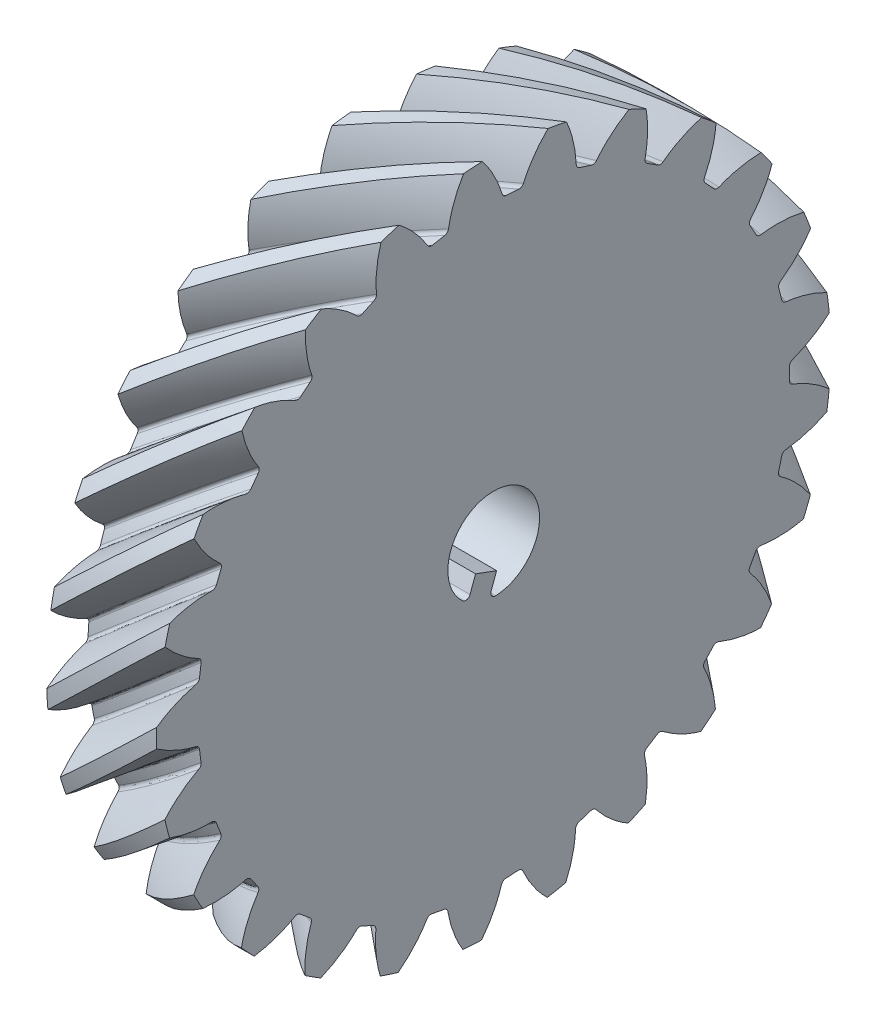
from build123d import *

# Parameters (mm, degrees)
BASPROSKE_W            = 12
BASPROSKE_H            = 36.754089775
TOOTHCUTLH_PITCH       = 239.137870171
TOOTHCUTLH_HEIGHT      = 12
TOOTHCUTLH_RADIUS      = 36.754089775
TOOTHCUTLH_START_ANGLE = -90
TEETHCUTSLH_COUNT      = 25
TEETHCUTSLH_ANGLE      = 345.6
BORSKE_R               = 5
BORE_DEPTH             = 62.5000025
BOSS_EXTRUDE1_DEPTH    = 12
FILLET1_R              = 0.5


with BuildPart() as part:
    # BasProSke → Base-Revolve (revolve)
    with BuildSketch(Plane(origin=(0, 0, 0), x_dir=(1, 0, 0), z_dir=(0, 1, 0)), mode=Mode.PRIVATE) as base_revolve_sk:
        with Locations((6, 18.377044888)):
            Rectangle(BASPROSKE_W, BASPROSKE_H)
    revolve(base_revolve_sk.sketch.rotate(Axis((-10, 0, 0), (1, 0, 0)), 180), axis=Axis((-10, 0, 0), (1, 0, 0)))

    # ToothCutLH: sweep along a helix
    with BuildLine() as toothcutlh_path:
        add(Helix(TOOTHCUTLH_PITCH, TOOTHCUTLH_HEIGHT, TOOTHCUTLH_RADIUS, center=(0, 0, 0), direction=(1, 0, 0), lefthand=True, mode=Mode.PRIVATE).rotate(Axis((0, 0, 0), (1, 0, 0)), TOOTHCUTLH_START_ANGLE))
    # TooCutSkeRH<3> → ToothCutLH (sweep, cut)
    with BuildSketch(Plane(origin=(0, 0, 0), x_dir=(0, 0, -1), z_dir=(1, 0, 0))):
        with BuildLine():
            ThreePointArc((0.679234719, 32.246937024), (0, 32.254089775), (-0.679234719, 32.246937024))
            ThreePointArc((-0.679234719, 32.246937024), (-0.971295349, 32.333394933), (-1.159304884, 32.57303382))
            ThreePointArc((-1.159304884, 32.57303382), (-2.568571771, 35.286618057), (-4.594479365, 37.576873716))
            ThreePointArc((-4.594479365, 37.576873716), (0, 37.856712469), (4.594479365, 37.576873716))
            ThreePointArc((4.594479365, 37.576873716), (2.568571771, 35.286618057), (1.159304884, 32.57303382))
            ThreePointArc((1.159304884, 32.57303382), (0.971295349, 32.333394933), (0.679234719, 32.246937024))
        make_face()
    toothcutlh = sweep(path=toothcutlh_path.line, is_frenet=True, mode=Mode.SUBTRACT)

    # TeethCutsLH: ToothCutLH ×25 about axis
    teethcutslh_axis = Axis((-10, 0, 0), (1, 0, 0))
    for i in range(1, TEETHCUTSLH_COUNT):
        add(toothcutlh.rotate(teethcutslh_axis, i * TEETHCUTSLH_ANGLE / (TEETHCUTSLH_COUNT - 1)), mode=Mode.SUBTRACT)

    # BorSke → Bore (cut, symmetric)
    with BuildSketch(Plane(origin=(0, 0, 0), x_dir=(0, 0, -1), z_dir=(1, 0, 0))):
        with Locations(Location((0, 0, 0), (0, 0, 180))):
            Circle(BORSKE_R)
    extrude(amount=BORE_DEPTH, both=True, mode=Mode.SUBTRACT)

    # Sketch3 → Boss-Extrude1 (add)
    with BuildSketch(Plane.ZY):
        Polygon((-0.320975533, -2.675287206), (1.978341282, -1.829308945), (3.140789046, -4.988770379), (0.84147223, -5.83474864), align=None)
    extrude(amount=-BOSS_EXTRUDE1_DEPTH)

    # Fillet1
    fillet1_edges = [part.edges().sort_by_distance(p)[0] for p in [
        (6, -4.126464589, 2.823524392),
        (6, -4.972444643, 0.524208237),
    ]]
    fillet(fillet1_edges, radius=FILLET1_R)


solid = part.part
